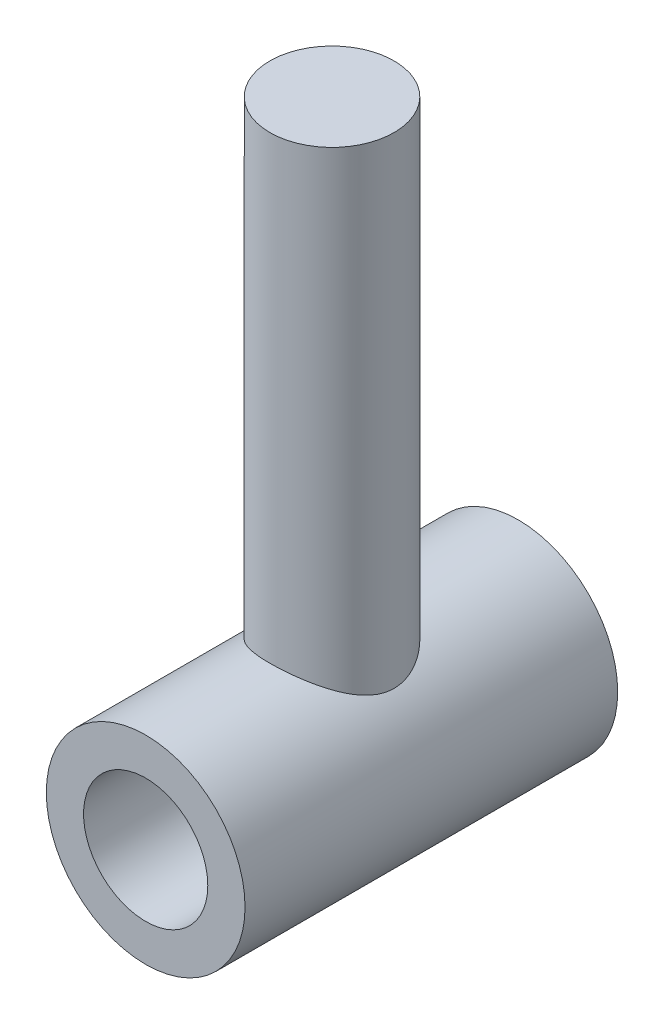
from build123d import *

# Parameters (mm, degrees)
SKETCH1_R                = 8
SKETCH1_R_2              = 5
EXTRUDE_THIN1_DEPTH      = 15
BOSS_EXTRUDE1_REACH      = 65.788
BOSS_EXTRUDE1_END_RADIUS = 8
BOSS_EXTRUDE1_START      = 45
SKETCH2_R                = 5


with BuildPart() as part:
    # Sketch1 → Extrude-Thin1 (new, symmetric)
    with BuildSketch(Plane.XY):
        Circle(SKETCH1_R)
        Circle(SKETCH1_R_2, mode=Mode.SUBTRACT)
    extrude(amount=EXTRUDE_THIN1_DEPTH, both=True)

    # Boss-Extrude1: up to this cylinder (the profile starts outside it)
    boss_extrude1_end = Plane(origin=(0, 0, 0), z_dir=(0, 0, -1)) * Cylinder(BOSS_EXTRUDE1_END_RADIUS, 148.576, mode=Mode.PRIVATE)
    # Sketch2 → Boss-Extrude1 (add, up to the surface)
    with BuildSketch(Plane(origin=(0, 0, 0), x_dir=(1, 0, 0), z_dir=(0, 1, 0)).offset(BOSS_EXTRUDE1_START), mode=Mode.PRIVATE) as boss_extrude1_sk1:
        Circle(SKETCH2_R)
    boss_extrude1_tool1 = extrude(boss_extrude1_sk1.sketch, amount=-BOSS_EXTRUDE1_REACH, mode=Mode.PRIVATE) - boss_extrude1_end
    add(boss_extrude1_tool1.solids().sort_by_distance((0, 45, 0))[0])


solid = part.part
